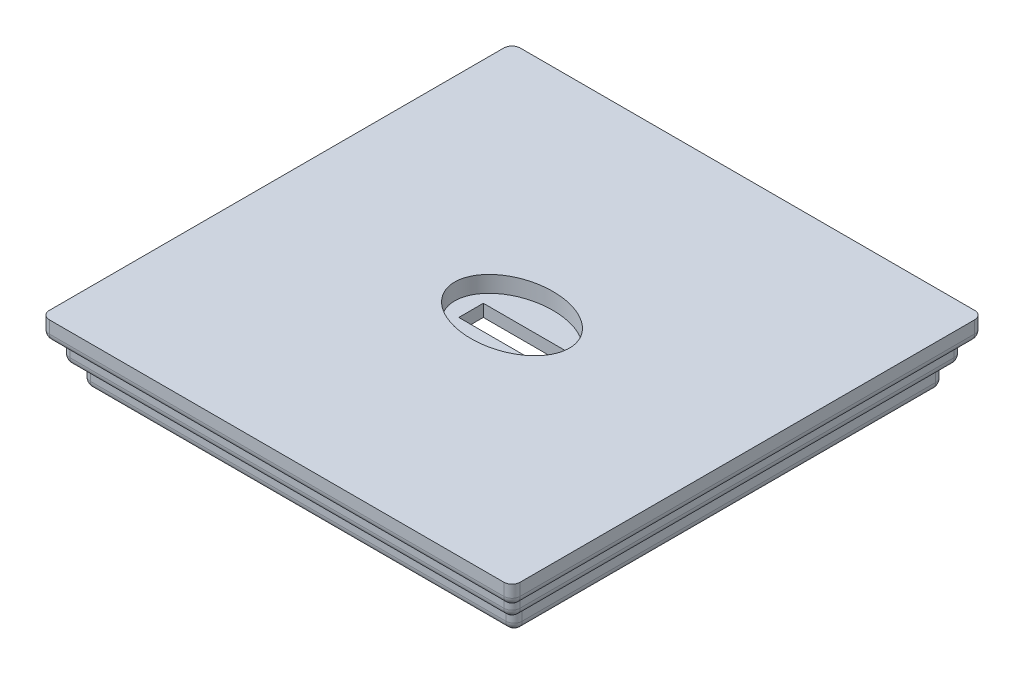
from build123d import *

# Parameters (mm, degrees)
BOSS_EXTRUDE4_DEPTH      = 26.25
BOSS_EXTRUDE4_DEPTH_BACK = 26.25
SKETCH7_W                = 52.75
SKETCH7_H                = 2.5
BOSS_EXTRUDE5_DEPTH      = 27.5
BOSS_EXTRUDE5_DEPTH_BACK = 27.5
SKETCH8_W                = 55
SKETCH8_H                = 2.5
BOSS_EXTRUDE6_DEPTH      = 28.75
BOSS_EXTRUDE6_DEPTH_BACK = 28.75
SKETCH9_W                = 57.5
SKETCH9_H                = 2.5
CUT_EXTRUDE1_DEPTH       = 4
CUT_EXTRUDE1_DEPTH_BACK  = 4.5
SKETCH10_W               = 45.6
SKETCH10_H               = 45.6
SKETCH12_RX              = 7
SKETCH12_RY              = 5
CUT_EXTRUDE2_DEPTH       = 2
CUT_EXTRUDE3_DEPTH       = 29
CUT_EXTRUDE3_DEPTH_BACK  = 42.344588521
SKETCH13_W               = 10
SKETCH13_H               = 3
FILLET4_R                = 1


with BuildPart() as part:
    # Sketch7 → Boss-Extrude4 (new, two sides: drawn at the far end of the back side and taken through both)
    with BuildSketch(Plane.XY.offset(-BOSS_EXTRUDE4_DEPTH_BACK)):
        with Locations((0.125, 1.25)):
            Rectangle(SKETCH7_W, SKETCH7_H)
    extrude(amount=BOSS_EXTRUDE4_DEPTH + BOSS_EXTRUDE4_DEPTH_BACK)

    # Sketch8 → Boss-Extrude5 (add, two sides: drawn at the far end of the back side and taken through both)
    with BuildSketch(Plane.XY.offset(-BOSS_EXTRUDE5_DEPTH_BACK)):
        with Locations((0, 3.75)):
            Rectangle(SKETCH8_W, SKETCH8_H)
    extrude(amount=BOSS_EXTRUDE5_DEPTH + BOSS_EXTRUDE5_DEPTH_BACK)

    # Sketch9 → Boss-Extrude6 (add, two sides: drawn at the far end of the back side and taken through both)
    with BuildSketch(Plane.XY.offset(-BOSS_EXTRUDE6_DEPTH_BACK)):
        with Locations((0, 6.25)):
            Rectangle(SKETCH9_W, SKETCH9_H)
    extrude(amount=BOSS_EXTRUDE6_DEPTH + BOSS_EXTRUDE6_DEPTH_BACK)

    # Sketch10 → Cut-Extrude1 (cut, two sides: drawn at the far end of the back side and taken through both)
    with BuildSketch(Plane(origin=(0, 0, 0), x_dir=(1, 0, 0), z_dir=(0, 1, 0)).offset(-CUT_EXTRUDE1_DEPTH_BACK)):
        Rectangle(SKETCH10_W, SKETCH10_H)
    extrude(amount=CUT_EXTRUDE1_DEPTH + CUT_EXTRUDE1_DEPTH_BACK, mode=Mode.SUBTRACT)

    # Sketch12 → Cut-Extrude2 (cut)
    with BuildSketch(Plane(origin=(0, 7.5, 0), x_dir=(1, 0, 0), z_dir=(0, 1, 0))):
        with Locations((0, 0)):
            Ellipse(SKETCH12_RX, SKETCH12_RY)
    extrude(amount=-CUT_EXTRUDE2_DEPTH, mode=Mode.SUBTRACT)

    # Sketch13 → Cut-Extrude3 (cut, two sides: drawn at the far end of the back side and taken through both)
    with BuildSketch(Plane(origin=(0, 0, 0), x_dir=(1, 0, 0), z_dir=(0, 1, 0)).offset(-CUT_EXTRUDE3_DEPTH_BACK)):
        Rectangle(SKETCH13_W, SKETCH13_H)
    extrude(amount=CUT_EXTRUDE3_DEPTH + CUT_EXTRUDE3_DEPTH_BACK, mode=Mode.SUBTRACT)

    # Fillet4
    fillet4_edges = [part.edges().sort_by_distance(p)[0] for p in [
        (-26.25, 1.25, 26.25),
        (26.5, 1.25, -26.25),
        (0.125, 0, 26.25),
        (26.5, 1.25, 26.25),
        (-27.5, 2.5, 0),
        (-27.5, 3.75, -27.5),
        (27.5, 3.75, -27.5),
        (27.5, 2.5, 0),
        (0, 2.5, -27.5),
        (-27.5, 3.75, 27.5),
        (0, 2.5, 27.5),
        (27.5, 3.75, 27.5),
        (-28.75, 5, 0),
        (-28.75, 6.25, -28.75),
        (28.75, 6.25, -28.75),
        (28.75, 5, 0),
        (0, 5, -28.75),
        (-28.75, 6.25, 28.75),
        (0, 5, 28.75),
        (28.75, 6.25, 28.75),
        (-26.25, 1.25, -26.25),
        (0, 0, -22.8),
        (22.8, 0, 0),
        (0, 0, 22.8),
        (-22.8, 0, 0),
        (26.5, 0, 0),
        (-26.25, 0, 0),
        (0.125, 0, -26.25),
    ]]
    fillet(fillet4_edges, radius=FILLET4_R - 0.0001)  # a hair under: the kernel refuses the full size


solid = part.part
